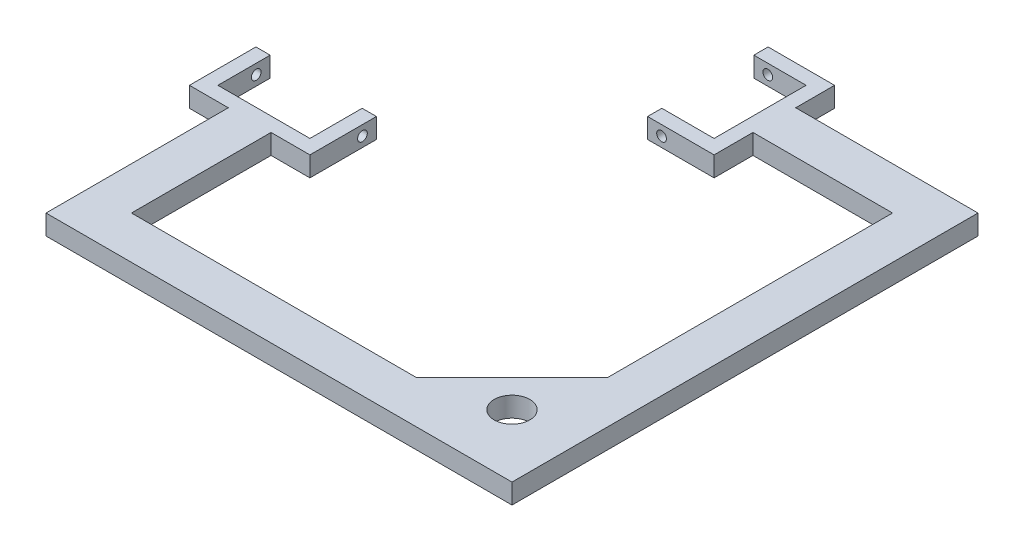
from build123d import *

# Parameters (mm, degrees)
SKETCH1_R           = 6.25
BOSS_EXTRUDE1_DEPTH = 7
SKETCH2_R           = 1.7
CUT_EXTRUDE1_DEPTH  = 50
SKETCH3_R           = 1.7
CUT_EXTRUDE2_DEPTH  = 50


with BuildPart() as part:
    # Sketch1 → Boss-Extrude1 (new body)
    with BuildSketch(Plane(origin=(0, 0, 0), x_dir=(1, 0, 0), z_dir=(0, 1, 0))):
        Polygon((-84.9, -24.655178012), (-84.9, -42.995178012), (-52.6, -42.995178012), (-52.6, -24.655178012), (-47.6, -24.655178012), (-47.6, -47.995178012), (-61.25, -47.995178012), (-61.25, -96.995178012), (38.75, -96.995178012), (72.34, -63.405178012), (72.34, 36.594821988), (23.34, 36.594821988), (23.34, 22.944821988), (0, 22.944821988), (0, 27.944821988), (18.34, 27.944821988), (18.34, 60.244821988), (0, 60.244821988), (0, 65.244821988), (23.34, 65.244821988), (23.34, 51.594821988), (87.34, 51.594821988), (87.34, -63.405178012), (87.34, -111.995178012), (38.75, -111.995178012), (-76.25, -111.995178012), (-76.25, -47.995178012), (-89.9, -47.995178012), (-89.9, -24.655178012), align=None)
        with Locations((65.34, -89.995178012)):
            Circle(SKETCH1_R, mode=Mode.SUBTRACT)
    extrude(amount=BOSS_EXTRUDE1_DEPTH)

    # Sketch2 → Cut-Extrude1 (cut)
    with BuildSketch(Plane.XY.offset(-22.944821988)):
        with Locations((4.9, 3.5)):
            Circle(SKETCH2_R)
    extrude(amount=-CUT_EXTRUDE1_DEPTH, mode=Mode.SUBTRACT)

    # Sketch3 → Cut-Extrude2 (cut)
    with BuildSketch(Plane(origin=(-47.6, 0, 0), x_dir=(0, 0, -1), z_dir=(1, 0, 0))):
        with Locations((-29.555178012, 3.5)):
            Circle(SKETCH3_R)
    extrude(amount=-CUT_EXTRUDE2_DEPTH, mode=Mode.SUBTRACT)


solid = part.part
